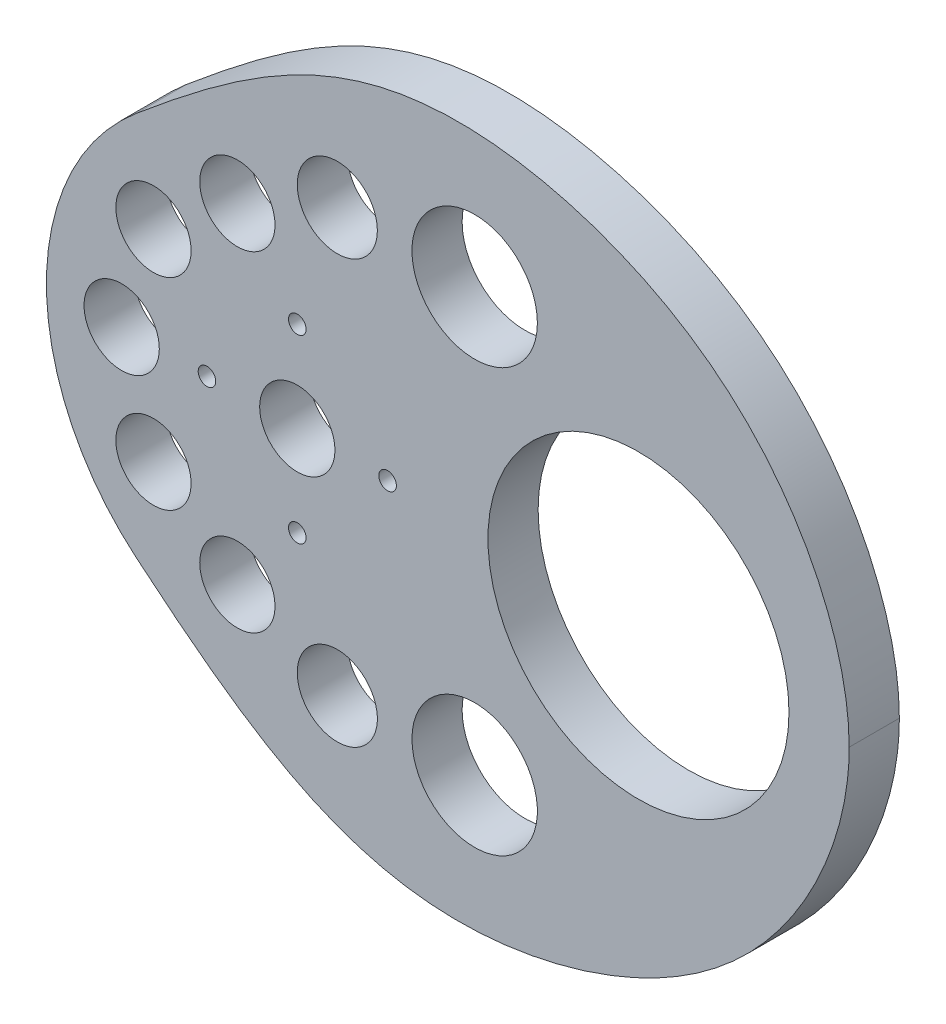
from build123d import *

# Parameters (mm, degrees)
BOSS_EXTRUDE1_DEPTH = 10
CUT_EXTRUDE2_REACH  = 132.234
SKETCH4_R           = 7.5
CUT_EXTRUDE4_REACH  = 132.234
SKETCH7_R           = 1.75
CUT_EXTRUDE5_REACH  = 132.234
SKETCH8_R           = 7.5
SKETCH8_R_2         = 30
SKETCH8_R_3         = 12.5
SKETCH8_R_4         = 7.981772892


# Read off the part's stored shape, not the designer's step: Boss-Extrude1
with BuildPart() as part:
    # Boss-Extrude1 outline → Boss-Extrude1 (new body)
    with BuildSketch(Plane.XY):
        with BuildLine():
            ThreePointArc((-32.139380484, 38.302222156), (-50, 0), (-32.139380484, -38.302222156))
            add(Edge.make_bspline(
                [(-32.139380484, -38.302222156), (14.909092409, -77.780578408), (28.422028264, -78.578436654), (76.215181346, -61.803371152), (80.103076656, -61.499859078), (110, -34.590055076), (110, 34.590055076), (80.103076656, 61.499859078), (76.215181346, 61.803371152), (28.422028264, 78.578436654), (14.909092409, 77.780578408), (-32.139380484, 38.302222156)],
                knots=[0, 0, 0, 0, 0, 0, 0, 1, 1, 1, 1, 1, 2, 2, 2, 2, 2, 2, 2], degree=6))
        make_face()
    extrude(amount=BOSS_EXTRUDE1_DEPTH)

    # Sketch4 → Cut-Extrude2 (cut, up to next)
    with BuildSketch(Plane.XY, mode=Mode.PRIVATE) as cut_extrude2_sk1:
        with Locations(Location((0, 0, 0), (0, 0, 180))):
            Circle(SKETCH4_R)
    cut_extrude2_tool1 = extrude(cut_extrude2_sk1.sketch, amount=CUT_EXTRUDE2_REACH, mode=Mode.PRIVATE) & part.part
    add(cut_extrude2_tool1.solids().sort_by_distance((0, 0, 0))[0], mode=Mode.SUBTRACT)

    # Sketch7 → Cut-Extrude4 (cut, up to next)
    with BuildSketch(Plane.XY.offset(10), mode=Mode.PRIVATE) as cut_extrude4_sk1:
        with Locations((0, 18)):
            Circle(SKETCH7_R)
    cut_extrude4_tool1 = extrude(cut_extrude4_sk1.sketch, amount=-CUT_EXTRUDE4_REACH, mode=Mode.PRIVATE) & part.part
    # Sketch7 → Cut-Extrude4 (cut, up to next)
    with BuildSketch(Plane.XY.offset(10), mode=Mode.PRIVATE) as cut_extrude4_sk2:
        with Locations((18, 0)):
            Circle(SKETCH7_R)
    cut_extrude4_tool2 = extrude(cut_extrude4_sk2.sketch, amount=-CUT_EXTRUDE4_REACH, mode=Mode.PRIVATE) & part.part
    # Sketch7 → Cut-Extrude4 (cut, up to next)
    with BuildSketch(Plane.XY.offset(10), mode=Mode.PRIVATE) as cut_extrude4_sk3:
        with Locations((-18, 0)):
            Circle(SKETCH7_R)
    cut_extrude4_tool3 = extrude(cut_extrude4_sk3.sketch, amount=-CUT_EXTRUDE4_REACH, mode=Mode.PRIVATE) & part.part
    # Sketch7 → Cut-Extrude4 (cut, up to next)
    with BuildSketch(Plane.XY.offset(10), mode=Mode.PRIVATE) as cut_extrude4_sk4:
        with Locations((0, -18)):
            Circle(SKETCH7_R)
    cut_extrude4_tool4 = extrude(cut_extrude4_sk4.sketch, amount=-CUT_EXTRUDE4_REACH, mode=Mode.PRIVATE) & part.part
    add(cut_extrude4_tool1.solids().sort_by_distance((0, 18, 10))[0], mode=Mode.SUBTRACT)
    add(cut_extrude4_tool2.solids().sort_by_distance((18, 0, 10))[0], mode=Mode.SUBTRACT)
    add(cut_extrude4_tool3.solids().sort_by_distance((-18, 0, 10))[0], mode=Mode.SUBTRACT)
    add(cut_extrude4_tool4.solids().sort_by_distance((0, -18, 10))[0], mode=Mode.SUBTRACT)

    # Sketch8 → Cut-Extrude5 (cut, up to next)
    with BuildSketch(Plane.XY.offset(10), mode=Mode.PRIVATE) as cut_extrude5_sk1:
        with Locations((-35, 0)):
            Circle(SKETCH8_R)
    cut_extrude5_tool1 = extrude(cut_extrude5_sk1.sketch, amount=-CUT_EXTRUDE5_REACH, mode=Mode.PRIVATE) & part.part
    # Sketch8 → Cut-Extrude5 (cut, up to next)
    with BuildSketch(Plane.XY.offset(10), mode=Mode.PRIVATE) as cut_extrude5_sk2:
        with Locations((68, 0)):
            Circle(SKETCH8_R_2)
    cut_extrude5_tool2 = extrude(cut_extrude5_sk2.sketch, amount=-CUT_EXTRUDE5_REACH, mode=Mode.PRIVATE) & part.part
    # Sketch8 → Cut-Extrude5 (cut, up to next)
    with BuildSketch(Plane.XY.offset(10), mode=Mode.PRIVATE) as cut_extrude5_sk3:
        with Locations((35.353318533, 42.132444372)):
            Circle(SKETCH8_R_3)
    cut_extrude5_tool3 = extrude(cut_extrude5_sk3.sketch, amount=-CUT_EXTRUDE5_REACH, mode=Mode.PRIVATE) & part.part
    # Sketch8 → Cut-Extrude5 (cut, up to next)
    with BuildSketch(Plane.XY.offset(10), mode=Mode.PRIVATE) as cut_extrude5_sk4:
        with Locations(Location((35.353318533, -42.132444372, 0), (0, 0, 180))):
            Circle(SKETCH8_R_3)
    cut_extrude5_tool4 = extrude(cut_extrude5_sk4.sketch, amount=-CUT_EXTRUDE5_REACH, mode=Mode.PRIVATE) & part.part
    # Sketch8 → Cut-Extrude5 (cut, up to next)
    with BuildSketch(Plane.XY.offset(10), mode=Mode.PRIVATE) as cut_extrude5_sk5:
        with Locations((-28.661329204, 20.088011555)):
            Circle(SKETCH8_R)
    cut_extrude5_tool5 = extrude(cut_extrude5_sk5.sketch, amount=-CUT_EXTRUDE5_REACH, mode=Mode.PRIVATE) & part.part
    # Sketch8 → Cut-Extrude5 (cut, up to next)
    with BuildSketch(Plane.XY.offset(10), mode=Mode.PRIVATE) as cut_extrude5_sk6:
        with Locations((-11.941245243, 32.899949271)):
            Circle(SKETCH8_R)
    cut_extrude5_tool6 = extrude(cut_extrude5_sk6.sketch, amount=-CUT_EXTRUDE5_REACH, mode=Mode.PRIVATE) & part.part
    # Sketch8 → Cut-Extrude5 (cut, up to next)
    with BuildSketch(Plane.XY.offset(10), mode=Mode.PRIVATE) as cut_extrude5_sk7:
        with Locations((7.977118384, 42.132444372)):
            Circle(SKETCH8_R_4)
    cut_extrude5_tool7 = extrude(cut_extrude5_sk7.sketch, amount=-CUT_EXTRUDE5_REACH, mode=Mode.PRIVATE) & part.part
    # Sketch8 → Cut-Extrude5 (cut, up to next)
    with BuildSketch(Plane.XY.offset(10), mode=Mode.PRIVATE) as cut_extrude5_sk8:
        with Locations(Location((7.977118384, -42.132444372, 0), (0, 0, 180))):
            Circle(SKETCH8_R_4)
    cut_extrude5_tool8 = extrude(cut_extrude5_sk8.sketch, amount=-CUT_EXTRUDE5_REACH, mode=Mode.PRIVATE) & part.part
    # Sketch8 → Cut-Extrude5 (cut, up to next)
    with BuildSketch(Plane.XY.offset(10), mode=Mode.PRIVATE) as cut_extrude5_sk9:
        with Locations(Location((-11.941245243, -32.899949271, 0), (0, 0, 180))):
            Circle(SKETCH8_R)
    cut_extrude5_tool9 = extrude(cut_extrude5_sk9.sketch, amount=-CUT_EXTRUDE5_REACH, mode=Mode.PRIVATE) & part.part
    # Sketch8 → Cut-Extrude5 (cut, up to next)
    with BuildSketch(Plane.XY.offset(10), mode=Mode.PRIVATE) as cut_extrude5_sk10:
        with Locations(Location((-28.661329204, -20.088011555, 0), (0, 0, 180))):
            Circle(SKETCH8_R)
    cut_extrude5_tool10 = extrude(cut_extrude5_sk10.sketch, amount=-CUT_EXTRUDE5_REACH, mode=Mode.PRIVATE) & part.part
    add(cut_extrude5_tool1.solids().sort_by_distance((-35, 0, 10))[0], mode=Mode.SUBTRACT)
    add(cut_extrude5_tool2.solids().sort_by_distance((68, 0, 10))[0], mode=Mode.SUBTRACT)
    add(cut_extrude5_tool3.solids().sort_by_distance((35.353319, 42.132444, 10))[0], mode=Mode.SUBTRACT)
    add(cut_extrude5_tool4.solids().sort_by_distance((35.353319, -42.132444, 10))[0], mode=Mode.SUBTRACT)
    add(cut_extrude5_tool5.solids().sort_by_distance((-28.661329, 20.088012, 10))[0], mode=Mode.SUBTRACT)
    add(cut_extrude5_tool6.solids().sort_by_distance((-11.941245, 32.899949, 10))[0], mode=Mode.SUBTRACT)
    add(cut_extrude5_tool7.solids().sort_by_distance((7.977118, 42.132444, 10))[0], mode=Mode.SUBTRACT)
    add(cut_extrude5_tool8.solids().sort_by_distance((7.977118, -42.132444, 10))[0], mode=Mode.SUBTRACT)
    add(cut_extrude5_tool9.solids().sort_by_distance((-11.941245, -32.899949, 10))[0], mode=Mode.SUBTRACT)
    add(cut_extrude5_tool10.solids().sort_by_distance((-28.661329, -20.088012, 10))[0], mode=Mode.SUBTRACT)


solid = part.part
